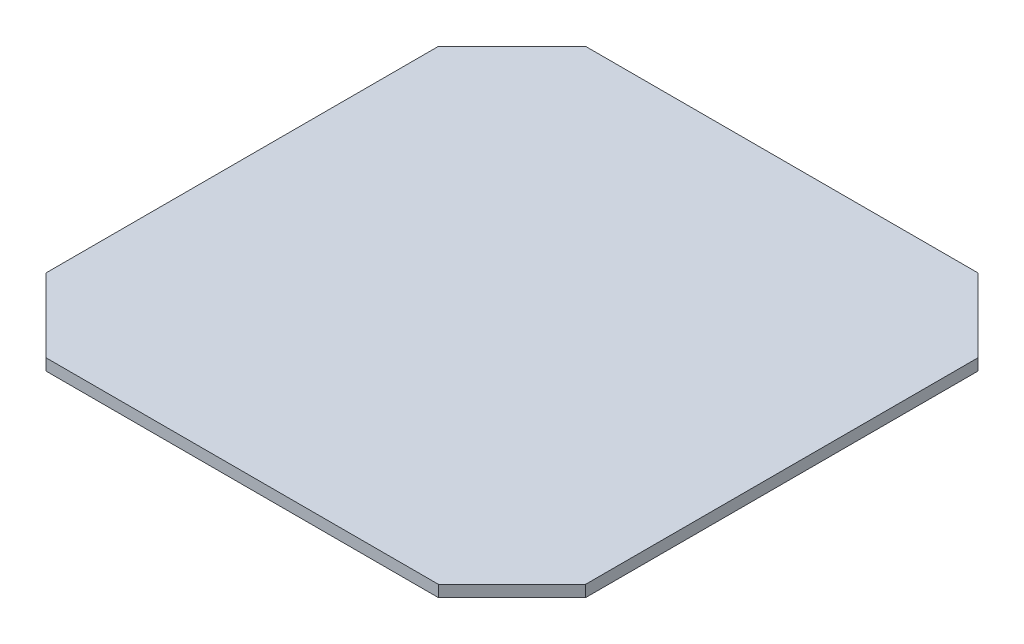
from build123d import *

# Parameters (mm, degrees)
BOSS_EXTRUDE1_DEPTH = 1


with BuildPart() as part:
    # Sketch1 → Boss-Extrude1 (new body)
    with BuildSketch(Plane(origin=(0, 0, 0), x_dir=(1, 0, 0), z_dir=(0, 1, 0))):
        Polygon((-23.363961031, 17), (-17, 23.363961031), (17, 23.363961031), (23.363961031, 17), (23.363961031, -17), (17, -23.363961031), (-17, -23.363961031), (-23.363961031, -17), align=None)
    extrude(amount=BOSS_EXTRUDE1_DEPTH)


solid = part.part
